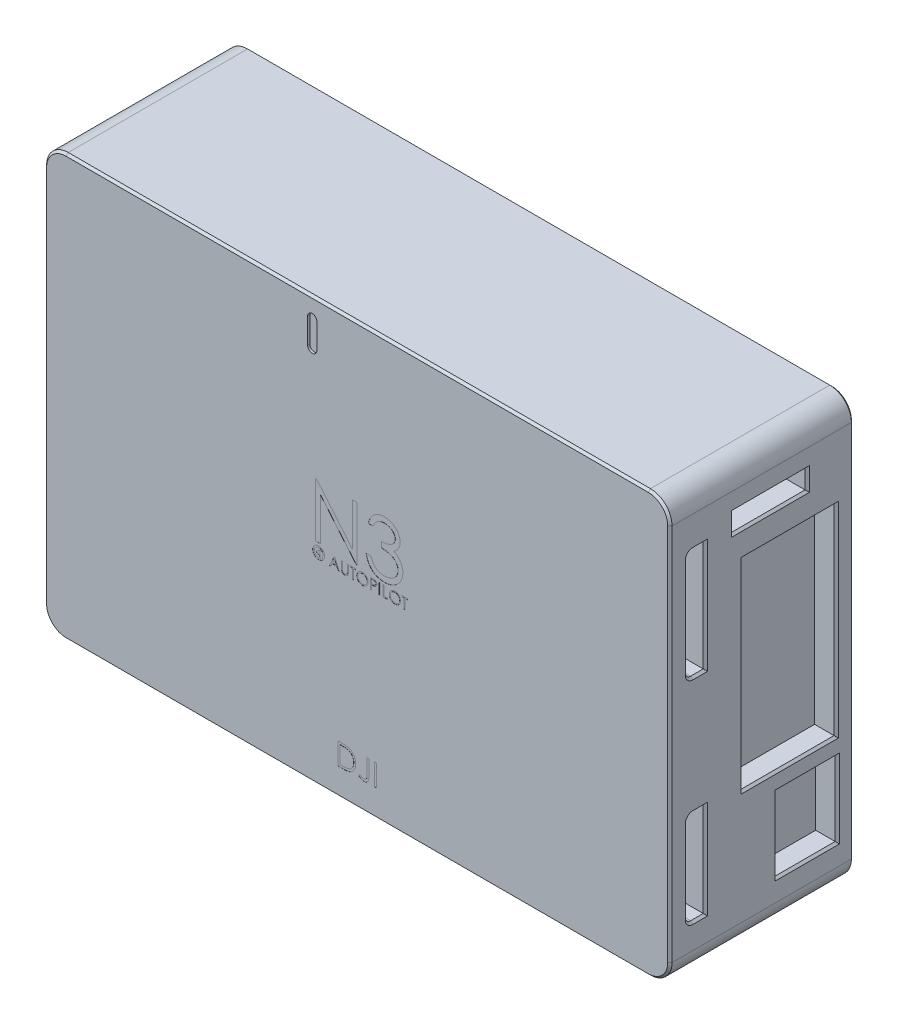
from build123d import *

# Parameters (mm, degrees)
SKETCH_1_W          = 57.9
SKETCH_1_H          = 39
EXTRUDE_1_DEPTH     = 8.5
WRAP_START          = -0.01
WRAP_1_OUTLINE_W    = 0.08974359
WRAP_1_OUTLINE_H    = 1
WRAP_1_OUTLINE_W_2  = 0.179487179
WRAP_1_OUTLINE_H_2  = 2
WRAP_1_DEPTH        = 0.01
WRAP_2_OUTLINE_R    = 0.550528327
WRAP_2_OUTLINE_R_2  = 0.409618736
WRAP_2_DEPTH        = 0.01
CUT_EXTRUDE_1_DEPTH = 0.2
FILLET_1_R          = 2
CUT_EXTRUDE_2_DEPTH = 2
SKETCH_6_W          = 7.8930681
SKETCH_6_H          = 2.741802603
SKETCH_6_H_2        = 8.807002301
SKETCH_6_H_3        = 8.142322883
CUT_EXTRUDE_3_DEPTH = 2
CHAMFER_1_SIZE      = 0.2
SKETCH_7_W          = 6.812964044
SKETCH_7_H          = 1.744783475
SKETCH_7_W_2        = 8.593393446
SKETCH_7_H_2        = 18.580781515
SKETCH_7_W_3        = 5.564428925
SKETCH_7_H_3        = 6.896048972
CUT_EXTRUDE_4_DEPTH = 2
CHAMFER_2_SIZE      = 0.2


# Read off the part's stored shape, not the designer's step: 包覆1, 包覆2
with BuildPart() as part:
    # 草图1 → 凸台-拉伸1 (new, symmetric)
    with BuildSketch(Plane.XY):
        Rectangle(SKETCH_1_W, SKETCH_1_H)
    extrude(amount=EXTRUDE_1_DEPTH, both=True)

    # 包覆1 outline → 包覆1 (cut)
    # profile 1 of 15: a face of its own
    with BuildSketch(Plane.XY.offset(8.5).offset(WRAP_START)):
        with BuildLine():
            add(Edge.make_bspline(
                [(4.022503773, -0.868523479), (4.022060935, -0.886511321), (4.02118805, -0.921967441), (4.013711257, -0.974008425), (4.001985257, -1.024034338), (3.985243466, -1.071961667), (3.963750473, -1.117840971), (3.937277567, -1.16155153), (3.906094364, -1.203107672), (3.870606692, -1.242054148), (3.83192068, -1.277767711), (3.790426318, -1.30888739), (3.747056798, -1.335665711), (3.701254024, -1.357032475), (3.653625442, -1.374110166), (3.603744778, -1.385753775), (3.551845763, -1.393264359), (3.516454048, -1.394126792), (3.498465311, -1.394565145)],
                knots=[0, 0, 0, 0, 0.065226504, 0.128568996, 0.190320378, 0.251377989, 0.312387528, 0.373788704, 0.43643116, 0.500566755, 0.564686795, 0.627135518, 0.688455409, 0.749245746, 0.810155177, 0.871670926, 0.934773496, 1, 1, 1, 1], degree=3))
            add(Edge.make_bspline(
                [(3.490452491, -0.343283094), (3.508969093, -0.343752088), (3.545337226, -0.344673231), (3.598787197, -0.351724404), (3.649814367, -0.363923087), (3.698834407, -0.380169653), (3.745260971, -0.401842335), (3.789443512, -0.428038091), (3.831276905, -0.459031365), (3.870197299, -0.494582573), (3.905813571, -0.53326356), (3.937192395, -0.574542963), (3.963490194, -0.618171192), (3.985086133, -0.664017143), (4.002028593, -0.711977134), (4.013719748, -0.762306849), (4.021187791, -0.814680189), (4.02206087, -0.850402151), (4.022503773, -0.868523479)],
                knots=[0, 0, 0, 0, 0.066570035, 0.130749041, 0.1934128, 0.254989399, 0.316113556, 0.377261758, 0.439400784, 0.502970589, 0.566524976, 0.628231103, 0.689090611, 0.749344669, 0.810169593, 0.871609824, 0.934869184, 1, 1, 1, 1], degree=3))
            add(Edge.make_bspline(
                [(2.971221722, -0.873331171), (2.971374475, -0.861436123), (2.971678054, -0.837796087), (2.975332823, -0.802691345), (2.980636166, -0.768151157), (2.988236713, -0.734273743), (2.998177189, -0.701142033), (3.00990634, -0.668527529), (3.02423201, -0.636760751), (3.040426481, -0.605691211), (3.058501283, -0.575803237), (3.078465783, -0.547551928), (3.099618745, -0.520700215), (3.122808286, -0.495943928), (3.147270128, -0.472562883), (3.173401093, -0.450916393), (3.201041734, -0.430809264), (3.230310985, -0.412689166), (3.260487635, -0.396300842), (3.291595286, -0.382237456), (3.323211449, -0.370167153), (3.355484206, -0.36038406), (3.388327855, -0.352660621), (3.421814079, -0.347401377), (3.455916201, -0.343737286), (3.478890864, -0.343435143), (3.490452491, -0.343283094)],
                knots=[0, 0, 0, 0, 0.043208986, 0.085872872, 0.128120007, 0.170151964, 0.211917621, 0.253753003, 0.296006409, 0.338443357, 0.381015368, 0.422820479, 0.464089056, 0.505125849, 0.545974971, 0.586985211, 0.628338592, 0.670083802, 0.711991602, 0.753039155, 0.794049395, 0.834885543, 0.875498313, 0.9165473, 0.958003779, 1, 1, 1, 1], degree=3))
            add(Edge.make_bspline(
                [(3.498465311, -1.394565145), (3.480344077, -1.394122463), (3.444622301, -1.393249819), (3.392183149, -1.385769418), (3.341818079, -1.374071903), (3.293671121, -1.357354921), (3.247715427, -1.335749998), (3.203861118, -1.30940589), (3.162284219, -1.278146706), (3.123329434, -1.242670542), (3.087686806, -1.204050099), (3.056612699, -1.162668883), (3.030262666, -1.119338753), (3.008730285, -1.07393946), (2.991683297, -1.026690476), (2.980053349, -0.977276626), (2.972528791, -0.925979624), (2.971661692, -0.891053082), (2.971221722, -0.873331171)],
                knots=[0, 0, 0, 0, 0.065818877, 0.129746527, 0.192071954, 0.253459424, 0.314569588, 0.376279881, 0.439025654, 0.503267029, 0.567492823, 0.629704796, 0.690999649, 0.751451651, 0.812004364, 0.873149681, 0.935635484, 1, 1, 1, 1], degree=3))
        make_face()
        with BuildLine():
            add(Edge.make_bspline(
                [(3.060965311, -0.87293053), (3.061329558, -0.887376879), (3.062046143, -0.915797316), (3.068319734, -0.957445357), (3.077983156, -0.997470582), (3.092228117, -1.035653984), (3.110042579, -1.07232378), (3.132050262, -1.107154667), (3.158124286, -1.140156059), (3.187742437, -1.171097565), (3.220120353, -1.199339223), (3.254501133, -1.224128768), (3.290516449, -1.245103125), (3.328260221, -1.262190289), (3.367530947, -1.275730214), (3.408581676, -1.285009823), (3.45113895, -1.291117096), (3.480147708, -1.291703598), (3.494859542, -1.292001043)],
                knots=[0, 0, 0, 0, 0.064503999, 0.126899322, 0.18774654, 0.248149733, 0.308586065, 0.369583005, 0.431826965, 0.496179723, 0.560667855, 0.623504455, 0.685260411, 0.746536822, 0.808327352, 0.870486188, 0.934316883, 1, 1, 1, 1], degree=3))
            add(Edge.make_bspline(
                [(3.494859542, -0.445847197), (3.485369647, -0.44596288), (3.46648058, -0.44619314), (3.438399284, -0.449226201), (3.410687303, -0.453549027), (3.383338914, -0.459715175), (3.356468546, -0.468116333), (3.329825734, -0.477785164), (3.303653433, -0.489562619), (3.278038045, -0.502869106), (3.253205166, -0.517597369), (3.229772966, -0.533875016), (3.207680782, -0.551320318), (3.186982706, -0.569973985), (3.167739514, -0.589931015), (3.149572456, -0.610888853), (3.133209718, -0.633446537), (3.118213839, -0.656992367), (3.104794456, -0.681495676), (3.092861498, -0.706698494), (3.083100352, -0.732806404), (3.075139674, -0.759536164), (3.068539728, -0.786845438), (3.064358606, -0.814941395), (3.061292218, -0.843682855), (3.061075119, -0.863106242), (3.060965311, -0.87293053)],
                knots=[0, 0, 0, 0, 0.042023329, 0.083644911, 0.124983795, 0.166247461, 0.207701556, 0.249631071, 0.29174177, 0.334742875, 0.377460169, 0.419556319, 0.461044176, 0.502096284, 0.542890714, 0.583800819, 0.624863583, 0.666224689, 0.707399186, 0.748556678, 0.789654591, 0.830739726, 0.872070142, 0.913993395, 0.95649813, 1, 1, 1, 1], degree=3))
            add(Edge.make_bspline(
                [(3.932760183, -0.868323158), (3.93264558, -0.858633014), (3.932418242, -0.839410828), (3.929406106, -0.810993452), (3.925091566, -0.78320682), (3.91887365, -0.756160019), (3.91085932, -0.729846155), (3.900977226, -0.704289941), (3.889324283, -0.679396171), (3.875950505, -0.655226372), (3.860917412, -0.63203359), (3.844490485, -0.609861472), (3.8263861, -0.589126403), (3.807121522, -0.56931649), (3.786215555, -0.550854236), (3.763762899, -0.533733516), (3.740036134, -0.517541152), (3.714914067, -0.502933848), (3.688987223, -0.489444068), (3.662383235, -0.477886638), (3.635403492, -0.468066033), (3.608116603, -0.459689757), (3.580292895, -0.453573177), (3.552120372, -0.449222305), (3.523638013, -0.446194195), (3.504482807, -0.44596323), (3.494859542, -0.445847197)],
                knots=[0, 0, 0, 0, 0.042915082, 0.085129971, 0.126473319, 0.167453038, 0.207976333, 0.248249378, 0.288749987, 0.329669857, 0.370537287, 0.411128564, 0.451818913, 0.492405877, 0.533485862, 0.575263062, 0.617440613, 0.660671688, 0.703940204, 0.746867522, 0.7890793, 0.831104042, 0.87323799, 0.91516577, 0.957380658, 1, 1, 1, 1], degree=3))
            add(Edge.make_bspline(
                [(3.494859542, -1.292001043), (3.504747971, -1.291865184), (3.524359696, -1.291595736), (3.553529845, -1.288881829), (3.582174477, -1.284529866), (3.610253414, -1.278263964), (3.637734789, -1.270421905), (3.664733304, -1.261105412), (3.690961387, -1.249482211), (3.716749912, -1.236639939), (3.741434553, -1.221999894), (3.76499899, -1.206274708), (3.78684927, -1.188855102), (3.807531862, -1.170478584), (3.826854059, -1.150774628), (3.844685197, -1.12976885), (3.860965235, -1.107328662), (3.87595542, -1.083818547), (3.889327781, -1.059248189), (3.900978952, -1.033953995), (3.910863556, -1.007998249), (3.918843129, -0.981343515), (3.925096118, -0.954040415), (3.929404667, -0.926052393), (3.932418506, -0.897435438), (3.932645671, -0.87808005), (3.932760183, -0.868323158)],
                knots=[0, 0, 0, 0, 0.043633218, 0.086537777, 0.129177336, 0.171436324, 0.213415895, 0.255265955, 0.297369481, 0.339940748, 0.382347459, 0.423952947, 0.464871163, 0.505572294, 0.546002577, 0.586567975, 0.627064799, 0.668270684, 0.709549225, 0.750428154, 0.791096194, 0.832027145, 0.873135955, 0.914610764, 0.956955986, 1, 1, 1, 1], degree=3))
        make_face(mode=Mode.SUBTRACT)
    # profile 2 of 15: a face of its own
    with BuildSketch(Plane.XY.offset(8.5).offset(WRAP_START)):
        with BuildLine():
            add(Edge.make_bspline(
                [(-1.378205128, -14.991346984), (-1.343079992, -14.991599882), (-1.275218412, -14.992088478), (-1.177154156, -14.995186415), (-1.086420578, -15.000666682), (-1.003316087, -15.008649268), (-0.927612537, -15.018451001), (-0.859521904, -15.030736947), (-0.798692108, -15.045244473), (-0.761280999, -15.057613301), (-0.743589744, -15.063462369)],
                knots=[0, 0, 0, 0, 0.164289216, 0.317405911, 0.458843612, 0.589366542, 0.707831319, 0.815770031, 0.912879903, 1, 1, 1, 1], degree=3))
            Line((-1.378205128, -14.991346984), (-1.782051282, -14.991346984))
            Line((-1.782051282, -14.991346984), (-1.782051282, -16.991346984))
            Line((-1.782051282, -16.991346984), (-1.162259615, -16.991346984))
            add(Edge.make_bspline(
                [(-0.141025641, -16.016587369), (-0.141385051, -16.041308077), (-0.142093306, -16.090022813), (-0.148452915, -16.161817611), (-0.157696526, -16.231482509), (-0.172007497, -16.298685766), (-0.189380361, -16.364016176), (-0.211645591, -16.426777459), (-0.237151589, -16.48754535), (-0.266894376, -16.545498193), (-0.299546596, -16.600402977), (-0.334587592, -16.652160422), (-0.37197999, -16.700031977), (-0.412080351, -16.744162613), (-0.454370475, -16.7844858), (-0.499127236, -16.82133838), (-0.546466122, -16.853999269), (-0.596175106, -16.883751902), (-0.649704323, -16.909706391), (-0.708067675, -16.931666397), (-0.771514062, -16.949864463), (-0.839887752, -16.965047832), (-0.913306882, -16.977092005), (-0.991843434, -16.985164229), (-1.075376742, -16.990623047), (-1.132736323, -16.991100987), (-1.162259615, -16.991346984)],
                knots=[0, 0, 0, 0, 0.046080683, 0.0908068, 0.134295271, 0.177024386, 0.218822734, 0.260244116, 0.301079867, 0.341613894, 0.381583419, 0.420119591, 0.458074619, 0.494738488, 0.531194623, 0.566933698, 0.602712651, 0.638326606, 0.674853249, 0.713467371, 0.754441804, 0.797815361, 0.843989456, 0.89307157, 0.944963346, 1, 1, 1, 1], degree=3))
            add(Edge.make_bspline(
                [(-0.743589744, -15.063462369), (-0.720449893, -15.072279915), (-0.674694926, -15.089715055), (-0.609547998, -15.12260437), (-0.54821922, -15.159868999), (-0.490379708, -15.201558064), (-0.437350665, -15.248851977), (-0.387060438, -15.29974174), (-0.34156631, -15.356077935), (-0.299904426, -15.416692214), (-0.262341192, -15.480870529), (-0.229690245, -15.548490591), (-0.202573678, -15.619208996), (-0.180063262, -15.69282908), (-0.162322429, -15.769512725), (-0.150218468, -15.84934922), (-0.142235046, -15.932023042), (-0.141432731, -15.988122736), (-0.141025641, -16.016587369)],
                knots=[0, 0, 0, 0, 0.061544966, 0.121694296, 0.181154855, 0.239875389, 0.298701942, 0.357647424, 0.417604843, 0.478494041, 0.540407051, 0.602344994, 0.665004328, 0.728559309, 0.793650542, 0.860534268, 0.929235961, 1, 1, 1, 1], degree=3))
        make_face()
        with BuildLine():
            add(Edge.make_bspline(
                [(-1.372996795, -16.786218779), (-1.340009154, -16.78607701), (-1.276561841, -16.785804336), (-1.1853287, -16.783411648), (-1.101969045, -16.779501969), (-1.026471039, -16.774030496), (-0.958877311, -16.766791288), (-0.899046597, -16.758719915), (-0.847175021, -16.748664229), (-0.815786771, -16.739549395), (-0.801282051, -16.735337369)],
                knots=[0, 0, 0, 0, 0.171900665, 0.330627932, 0.475548836, 0.60674619, 0.725023803, 0.829742387, 0.92132282, 1, 1, 1, 1], degree=3))
            Line((-1.372996795, -16.786218779), (-1.602564103, -16.786218779))
            Line((-1.602564103, -16.786218779), (-1.602564103, -15.19647519))
            Line((-1.602564103, -15.19647519), (-1.461939103, -15.19647519))
            add(Edge.make_bspline(
                [(-0.847355769, -15.252564933), (-0.864127853, -15.247926974), (-0.899789904, -15.238065401), (-0.957983884, -15.227308046), (-1.023478255, -15.217819761), (-1.096563799, -15.209786595), (-1.177157204, -15.204022412), (-1.265320454, -15.199695946), (-1.361091657, -15.19677787), (-1.427481676, -15.196578609), (-1.461939103, -15.19647519)],
                knots=[0, 0, 0, 0, 0.084318617, 0.179284514, 0.286582528, 0.405111483, 0.535592873, 0.67819021, 0.83297584, 1, 1, 1, 1], degree=3))
            add(Edge.make_bspline(
                [(-0.320512821, -16.016186728), (-0.320806128, -15.992796168), (-0.321382332, -15.946845205), (-0.328624795, -15.879421951), (-0.339208541, -15.814575865), (-0.354513504, -15.75230261), (-0.374016864, -15.692480695), (-0.398356659, -15.635440975), (-0.426166156, -15.58058105), (-0.459253777, -15.529167126), (-0.495491259, -15.480542493), (-0.53570719, -15.435996827), (-0.57926264, -15.395428655), (-0.625682554, -15.358206191), (-0.676275183, -15.325826947), (-0.72984872, -15.296863129), (-0.787189104, -15.27228262), (-0.827082073, -15.259208984), (-0.847355769, -15.252564933)],
                knots=[0, 0, 0, 0, 0.070151176, 0.137812606, 0.203226247, 0.267174055, 0.330024003, 0.391794272, 0.453084399, 0.514333908, 0.574999993, 0.634865483, 0.694116315, 0.753441622, 0.8131258, 0.874079686, 0.936007013, 1, 1, 1, 1], degree=3))
            add(Edge.make_bspline(
                [(-0.801282051, -16.735337369), (-0.783025844, -16.728907907), (-0.74694948, -16.716202551), (-0.695017431, -16.693026745), (-0.646584857, -16.665574133), (-0.6008077, -16.635058548), (-0.558335325, -16.60040369), (-0.518664401, -16.562363125), (-0.481874801, -16.520743253), (-0.448346625, -16.475595733), (-0.41834188, -16.427201564), (-0.39235832, -16.376036516), (-0.369586016, -16.322661196), (-0.351712535, -16.266255962), (-0.337703629, -16.207325072), (-0.327780951, -16.145864378), (-0.321601108, -16.08188536), (-0.320880281, -16.038369861), (-0.320512821, -16.016186728)],
                knots=[0, 0, 0, 0, 0.0624145, 0.123338231, 0.183124538, 0.241782995, 0.300578883, 0.359680075, 0.418881641, 0.479530664, 0.540850536, 0.602303396, 0.664463212, 0.727805723, 0.792894815, 0.859672328, 0.928464401, 1, 1, 1, 1], degree=3))
        make_face(mode=Mode.SUBTRACT)
    # profile 3 of 15: a face of its own
    with BuildSketch(Plane.XY.offset(8.5).offset(WRAP_START)):
        with BuildLine():
            add(Edge.make_bspline(
                [(1.08974359, -16.341907882), (1.089564208, -16.366882265), (1.089219772, -16.414836129), (1.087325823, -16.483906926), (1.083820979, -16.54697589), (1.078715257, -16.604186431), (1.071903696, -16.65535932), (1.064108823, -16.700889959), (1.054672938, -16.740398348), (1.040463528, -16.784761409), (1.017164129, -16.833415012), (0.98209725, -16.885960812), (0.938535652, -16.931922761), (0.888077919, -16.971838604), (0.830283048, -17.003642736), (0.766341208, -17.026474266), (0.696646016, -17.04040047), (0.648303609, -17.041871273), (0.623397436, -17.042629036)],
                knots=[0, 0, 0, 0, 0.077360684, 0.148541953, 0.214007737, 0.272994503, 0.326409196, 0.373880401, 0.416019938, 0.45212552, 0.518001711, 0.58236693, 0.647043782, 0.713330421, 0.78091197, 0.850394959, 0.922922974, 1, 1, 1, 1], degree=3))
            Line((1.08974359, -16.341907882), (1.08974359, -14.991346984))
            Line((1.08974359, -14.991346984), (0.91025641, -14.991346984))
            Line((0.91025641, -14.991346984), (0.91025641, -16.321875831))
            add(Edge.make_bspline(
                [(0.633413462, -16.837500831), (0.647232198, -16.836916411), (0.674546744, -16.835761228), (0.714240455, -16.825561642), (0.752216473, -16.809993412), (0.78711342, -16.787198387), (0.819276499, -16.760094718), (0.845815256, -16.727319856), (0.867939396, -16.690996436), (0.881253506, -16.656612748), (0.889736233, -16.625254674), (0.89512002, -16.596435739), (0.899827826, -16.562743466), (0.90393157, -16.524137637), (0.906334124, -16.480540961), (0.909029709, -16.432081451), (0.910004144, -16.37863693), (0.910169755, -16.341373529), (0.91025641, -16.321875831)],
                knots=[0, 0, 0, 0, 0.062326366, 0.123196245, 0.18403622, 0.246964085, 0.310699396, 0.373267637, 0.43658758, 0.502124791, 0.539004722, 0.583255376, 0.634446515, 0.692676046, 0.758570486, 0.831658675, 0.911917102, 1, 1, 1, 1], degree=3))
            add(Edge.make_bspline(
                [(0.502403846, -16.808654677), (0.513423453, -16.812974367), (0.535035355, -16.82144624), (0.568078258, -16.83090104), (0.600932565, -16.836068131), (0.622714104, -16.837028893), (0.633413462, -16.837500831)],
                knots=[0, 0, 0, 0, 0.262951626, 0.515706692, 0.762109227, 1, 1, 1, 1], degree=3))
            add(Edge.make_bspline(
                [(0.246794872, -16.658013651), (0.271196403, -16.674840735), (0.317269675, -16.706612462), (0.384986498, -16.747484806), (0.444984871, -16.782527757), (0.48423227, -16.800386203), (0.502403846, -16.808654677)],
                knots=[0, 0, 0, 0, 0.299184288, 0.564898946, 0.798547869, 1, 1, 1, 1], degree=3))
            Line((0.246794872, -16.658013651), (0.141025641, -16.811859805))
            add(Edge.make_bspline(
                [(0.623397436, -17.042629036), (0.60399266, -17.042011545), (0.564948965, -17.040769112), (0.506839988, -17.030642419), (0.448896002, -17.015033251), (0.39080946, -16.992174625), (0.331432751, -16.961085712), (0.269961695, -16.920408674), (0.205605586, -16.87021923), (0.163215137, -16.831911947), (0.141025641, -16.811859805)],
                knots=[0, 0, 0, 0, 0.106070902, 0.21342168, 0.321685488, 0.433857939, 0.554081283, 0.687587044, 0.83646585, 1, 1, 1, 1], degree=3))
        make_face()
    # profile 4 of 15: a face of its own
    with BuildSketch(Plane.XY.offset(8.5).offset(WRAP_START)):
        with BuildLine():
            add(Edge.make_bspline(
                [(-1.362111612, -0.968082774), (-1.362124967, -0.976562984), (-1.362150311, -0.992655644), (-1.361981022, -1.015560873), (-1.361506916, -1.035924433), (-1.361208014, -1.053824818), (-1.360543061, -1.069179888), (-1.360000762, -1.082072834), (-1.35930346, -1.092442606), (-1.358465427, -1.098494299), (-1.358105201, -1.101095594)],
                knots=[0, 0, 0, 0, 0.191078592, 0.362604556, 0.51609875, 0.650038026, 0.765976721, 0.862374026, 0.940842058, 1, 1, 1, 1], degree=3))
            Line((-1.362111612, -0.968082774), (-1.362111612, -0.36892412))
            Line((-1.362111612, -0.36892412), (-1.451855201, -0.36892412))
            Line((-1.451855201, -0.36892412), (-1.451855201, -0.972890466))
            add(Edge.make_bspline(
                [(-1.434026676, -1.183627645), (-1.435505864, -1.178304053), (-1.438714256, -1.166757062), (-1.442150055, -1.147646636), (-1.445038364, -1.125642374), (-1.447754238, -1.100742769), (-1.449356797, -1.072928521), (-1.45076178, -1.042211688), (-1.451865099, -1.008555128), (-1.451858593, -0.98511098), (-1.451855201, -0.972890466)],
                knots=[0, 0, 0, 0, 0.078129865, 0.169465417, 0.274335291, 0.392110163, 0.52368733, 0.668365421, 0.827131902, 1, 1, 1, 1], degree=3))
            add(Edge.make_bspline(
                [(-1.121526676, -1.394565145), (-1.131146419, -1.394340927), (-1.150020322, -1.393901011), (-1.177831198, -1.391380225), (-1.204492397, -1.386632112), (-1.230285505, -1.380586414), (-1.254859361, -1.372248203), (-1.278543202, -1.362505882), (-1.300931397, -1.35054095), (-1.322387148, -1.337228552), (-1.342337078, -1.322250084), (-1.360650622, -1.30592432), (-1.377358014, -1.288512784), (-1.392177641, -1.269826965), (-1.405355037, -1.250012192), (-1.416706526, -1.229012409), (-1.426453168, -1.206835747), (-1.431483615, -1.191420547), (-1.434026676, -1.183627645)],
                knots=[0, 0, 0, 0, 0.071174504, 0.139644122, 0.206317224, 0.27137324, 0.335418084, 0.398076345, 0.460607915, 0.522969511, 0.584715724, 0.64489494, 0.704290561, 0.76299819, 0.821087431, 0.880103891, 0.939388488, 1, 1, 1, 1], degree=3))
            add(Edge.make_bspline(
                [(-0.81082956, -0.972890466), (-0.810902166, -0.983775717), (-0.811043861, -1.005018946), (-0.812272597, -1.036147906), (-0.81423174, -1.065677329), (-0.816999765, -1.093611186), (-0.82066748, -1.119849517), (-0.824746115, -1.144622308), (-0.829940267, -1.167751734), (-0.836006953, -1.189418139), (-0.842942252, -1.210042572), (-0.851925438, -1.229616461), (-0.862046723, -1.248734861), (-0.87405091, -1.267108607), (-0.887539876, -1.284819051), (-0.902811785, -1.301758786), (-0.919361545, -1.318198514), (-0.937464277, -1.333716533), (-0.95682157, -1.347947583), (-0.977375843, -1.360461232), (-0.998969206, -1.371039408), (-1.021545528, -1.379746815), (-1.045114443, -1.386293844), (-1.069676546, -1.39117246), (-1.095287744, -1.393944545), (-1.112706217, -1.394356525), (-1.121526676, -1.394565145)],
                knots=[0, 0, 0, 0, 0.054858035, 0.107058792, 0.156978355, 0.203992277, 0.248491536, 0.290483314, 0.330489004, 0.367885926, 0.403858131, 0.440009343, 0.476295011, 0.512792295, 0.550484825, 0.588381116, 0.627645327, 0.667979464, 0.708432758, 0.748602302, 0.789087777, 0.829461205, 0.870371045, 0.912214227, 0.955546575, 1, 1, 1, 1], degree=3))
            Line((-0.81082956, -0.972890466), (-0.81082956, -0.36892412))
            Line((-0.81082956, -0.36892412), (-0.90057315, -0.36892412))
            Line((-0.90057315, -0.36892412), (-0.90057315, -0.968082774))
            add(Edge.make_bspline(
                [(-0.910789496, -1.123331171), (-0.909932318, -1.119803007), (-0.908022178, -1.111940835), (-0.906237308, -1.098649038), (-0.904378301, -1.082966363), (-0.903088424, -1.064780131), (-0.901830932, -1.044151281), (-0.901078626, -1.02097235), (-0.900730902, -0.995327505), (-0.900627279, -0.977431173), (-0.90057315, -0.968082774)],
                knots=[0, 0, 0, 0, 0.069835104, 0.155620755, 0.257801557, 0.373811234, 0.506402493, 0.655564458, 0.820079282, 1, 1, 1, 1], degree=3))
            add(Edge.make_bspline(
                [(-1.126534689, -1.292001043), (-1.118376477, -1.291694228), (-1.102107174, -1.291082372), (-1.077933908, -1.287293391), (-1.05439102, -1.280464658), (-1.031362254, -1.271653299), (-1.009776258, -1.26001113), (-0.989620989, -1.246562319), (-0.971631294, -1.230787783), (-0.955214723, -1.213330541), (-0.940919027, -1.193633456), (-0.928527272, -1.172125416), (-0.918377007, -1.148482746), (-0.913364571, -1.131867197), (-0.910789496, -1.123331171)],
                knots=[0, 0, 0, 0, 0.082890648, 0.165302541, 0.247761876, 0.331527711, 0.415279813, 0.49636623, 0.577151348, 0.65778254, 0.739321642, 0.823793082, 0.909475953, 1, 1, 1, 1], degree=3))
            add(Edge.make_bspline(
                [(-1.358105201, -1.101095594), (-1.356625927, -1.110480384), (-1.353750731, -1.128721163), (-1.346423195, -1.154694958), (-1.336189623, -1.178103946), (-1.324063039, -1.199678601), (-1.308082293, -1.218818418), (-1.288938426, -1.236450319), (-1.265744778, -1.251870834), (-1.239956034, -1.265971066), (-1.212160251, -1.277303947), (-1.183757032, -1.28587348), (-1.155173324, -1.291096023), (-1.136037277, -1.291700748), (-1.126534689, -1.292001043)],
                knots=[0, 0, 0, 0, 0.086315004, 0.167766466, 0.244432684, 0.318134662, 0.391884107, 0.47006805, 0.553904179, 0.644339498, 0.736874663, 0.826168364, 0.913678595, 1, 1, 1, 1], degree=3))
        make_face()
    # profile 5 of 15: a face of its own
    with BuildSketch(Plane.XY.offset(8.5).offset(WRAP_START)):
        with BuildLine():
            add(Edge.make_bspline(
                [(1.025641026, 3.846153846), (1.037797527, 3.896485966), (1.061562492, 3.994881144), (1.111130454, 4.135462945), (1.16512939, 4.268496547), (1.229970968, 4.391490938), (1.300697759, 4.506917942), (1.381730219, 4.612159548), (1.469329822, 4.709892356), (1.566222607, 4.796625553), (1.667834981, 4.875165166), (1.775598723, 4.942129533), (1.887345714, 4.999735466), (2.00385019, 5.04719294), (2.125459007, 5.082943688), (2.251072754, 5.108881982), (2.381020612, 5.125726431), (2.469231455, 5.127370378), (2.514022436, 5.128205128)],
                knots=[0, 0, 0, 0, 0.072625346, 0.141976611, 0.208984928, 0.27395687, 0.336889347, 0.398744953, 0.460115885, 0.520824923, 0.580994459, 0.640151928, 0.698622451, 0.757271081, 0.816426694, 0.876254048, 0.937165293, 1, 1, 1, 1], degree=3))
            Line((1.025641026, 3.846153846), (1.474358974, 3.846153846))
            add(Edge.make_bspline(
                [(2.520032051, 4.615384615), (2.463101097, 4.613396955), (2.351901702, 4.609514593), (2.191594678, 4.575510288), (2.042567058, 4.521255883), (1.928654677, 4.456494427), (1.844536714, 4.392565236), (1.784426802, 4.336733255), (1.725397502, 4.274686364), (1.671332249, 4.202602971), (1.61665514, 4.125364699), (1.566877195, 4.039045154), (1.518506206, 3.945896019), (1.489359706, 3.880045113), (1.474358974, 3.846153846)],
                knots=[0, 0, 0, 0, 0.122711942, 0.239684964, 0.351815855, 0.463766133, 0.520817793, 0.579448291, 0.640604145, 0.705297512, 0.773633881, 0.844669382, 0.920056508, 1, 1, 1, 1], degree=3))
            add(Edge.make_bspline(
                [(3.525641026, 3.831129808), (3.52504901, 3.857240872), (3.523871223, 3.909187597), (3.509017969, 3.985080552), (3.48669791, 4.058653332), (3.456012583, 4.129593061), (3.41494087, 4.197407738), (3.365789461, 4.262675522), (3.307263603, 4.325023778), (3.240198679, 4.38313852), (3.168181815, 4.438523144), (3.089253565, 4.485542626), (3.005793744, 4.525749857), (2.917709951, 4.558906289), (2.824716336, 4.583848129), (2.727249826, 4.601756474), (2.625124563, 4.612953124), (2.555450661, 4.614565146), (2.520032051, 4.615384615)],
                knots=[0, 0, 0, 0, 0.055274549, 0.109966094, 0.163247443, 0.218076185, 0.273300874, 0.3309093, 0.390994523, 0.454175953, 0.518861541, 0.583310532, 0.648516682, 0.715030887, 0.782502073, 0.852322685, 0.92492849, 1, 1, 1, 1], degree=3))
            add(Edge.make_bspline(
                [(2.243589744, 3.012820513), (2.305448552, 3.013870232), (2.426614761, 3.015926375), (2.603606625, 3.040794962), (2.772854214, 3.075195859), (2.930606702, 3.127888991), (3.074390579, 3.189089415), (3.199132867, 3.260306857), (3.303085935, 3.339470784), (3.385744608, 3.427803083), (3.447929221, 3.522538865), (3.493396074, 3.621276948), (3.520253683, 3.724882749), (3.523838922, 3.795589418), (3.525641026, 3.831129808)],
                knots=[0, 0, 0, 0, 0.110165553, 0.215787256, 0.318027435, 0.417573954, 0.511650488, 0.596162097, 0.672934533, 0.743669557, 0.810677001, 0.874058962, 0.936696302, 1, 1, 1, 1], degree=3))
            Line((2.243589744, 3.012820513), (2.243589744, 2.5))
            add(Edge.make_bspline(
                [(3.782051282, 1.442307692), (3.779865137, 1.488895319), (3.775503725, 1.58183876), (3.742205754, 1.718578151), (3.687435948, 1.850325884), (3.610760932, 1.974834155), (3.517424177, 2.0902283), (3.408331453, 2.193187561), (3.282576841, 2.278144834), (3.166834171, 2.336842914), (3.064312519, 2.376895879), (2.976576255, 2.403574399), (2.878352536, 2.426165336), (2.770829181, 2.447182867), (2.653196014, 2.465070507), (2.525581103, 2.479987387), (2.387958586, 2.49192316), (2.292685492, 2.497253296), (2.243589744, 2.5)],
                knots=[0, 0, 0, 0, 0.066909186, 0.13348544, 0.201035117, 0.27123434, 0.342879984, 0.41383613, 0.485976622, 0.560229557, 0.599884181, 0.64405484, 0.691891932, 0.744687524, 0.801491775, 0.862857698, 0.929328379, 1, 1, 1, 1], degree=3))
            add(Edge.make_bspline(
                [(2.509014423, 0.384615385), (2.555805141, 0.385495249), (2.647300351, 0.387215749), (2.780807293, 0.403038187), (2.907817932, 0.426081635), (3.026922112, 0.46167161), (3.13967998, 0.505644255), (3.244510908, 0.560856263), (3.342791059, 0.625634437), (3.433261639, 0.699261806), (3.514612364, 0.779863942), (3.58624024, 0.864168329), (3.647132613, 0.951819514), (3.696252011, 1.043302544), (3.735038511, 1.138238585), (3.761443083, 1.236894056), (3.779802391, 1.338461579), (3.781297551, 1.407502963), (3.782051282, 1.442307692)],
                knots=[0, 0, 0, 0, 0.076071737, 0.148751715, 0.218402794, 0.285759581, 0.350598024, 0.414964045, 0.478069339, 0.541760676, 0.604349859, 0.664075021, 0.721463623, 0.777587128, 0.832644447, 0.887843511, 0.943460343, 1, 1, 1, 1], degree=3))
            add(Edge.make_bspline(
                [(1.673677885, 0.655048077), (1.701672994, 0.633464743), (1.757576798, 0.590364697), (1.848674271, 0.535362371), (1.944481251, 0.487703763), (2.047073643, 0.451298484), (2.154237601, 0.420473254), (2.267705265, 0.400301084), (2.386475575, 0.386460839), (2.46757238, 0.385239508), (2.509014423, 0.384615385)],
                knots=[0, 0, 0, 0, 0.118271305, 0.236177533, 0.355662933, 0.475904165, 0.600127342, 0.728608116, 0.861313476, 1, 1, 1, 1], degree=3))
            add(Edge.make_bspline(
                [(1.282051282, 1.346153846), (1.293741698, 1.307655256), (1.316480574, 1.232772153), (1.355186714, 1.125000288), (1.399284245, 1.026203069), (1.446590758, 0.935655752), (1.496274252, 0.852466606), (1.551867002, 0.778835364), (1.609251495, 0.711527933), (1.652507714, 0.673607058), (1.673677885, 0.655048077)],
                knots=[0, 0, 0, 0, 0.149770386, 0.29131641, 0.425966373, 0.552159574, 0.671527414, 0.786121629, 0.895325073, 1, 1, 1, 1], degree=3))
            Line((1.282051282, 1.346153846), (0.833333333, 1.346153846))
            add(Edge.make_bspline(
                [(2.501001603, -0.128205128), (2.447545459, -0.126964824), (2.342361595, -0.124524318), (2.187728026, -0.107840602), (2.040125598, -0.077369166), (1.899354744, -0.036364444), (1.765290406, 0.015623759), (1.638341685, 0.080364757), (1.517727551, 0.156524045), (1.404586192, 0.245000599), (1.298931096, 0.343973942), (1.203570061, 0.455201099), (1.116913214, 0.576625962), (1.041280873, 0.709658899), (0.973228083, 0.852580695), (0.917255288, 1.007221407), (0.86799019, 1.172198581), (0.845085241, 1.287166782), (0.833333333, 1.346153846)],
                knots=[0, 0, 0, 0, 0.06554117, 0.128963168, 0.190377136, 0.250092362, 0.308548432, 0.366397963, 0.424542189, 0.483169996, 0.5422434, 0.601739352, 0.662506002, 0.724855513, 0.789127829, 0.8563464, 0.926295235, 1, 1, 1, 1], degree=3))
            add(Edge.make_bspline(
                [(4.230769231, 1.485376603), (4.22820564, 1.415362715), (4.223090523, 1.275664427), (4.177370417, 1.069271967), (4.106494359, 0.86752125), (4.005841593, 0.674557194), (3.883173723, 0.494013792), (3.737234689, 0.332476208), (3.569682677, 0.193621059), (3.382817464, 0.077606447), (3.180364423, -0.015133441), (2.963827863, -0.079501217), (2.736327786, -0.121424074), (2.580317361, -0.125919601), (2.501001603, -0.128205128)],
                knots=[0, 0, 0, 0, 0.079648251, 0.158921676, 0.239619495, 0.32260943, 0.406034637, 0.487602095, 0.569684627, 0.653036145, 0.737435718, 0.822477816, 0.909747655, 1, 1, 1, 1], degree=3))
            add(Edge.make_bspline(
                [(3.932291667, 2.373798077), (3.956350727, 2.340858432), (4.004074864, 2.275518551), (4.06298277, 2.170466514), (4.116424362, 2.064250101), (4.158067532, 1.954022378), (4.190315913, 1.84106093), (4.213367388, 1.725171792), (4.227687589, 1.606260332), (4.229738378, 1.525813932), (4.230769231, 1.485376603)],
                knots=[0, 0, 0, 0, 0.12813551, 0.254172712, 0.378111645, 0.501712263, 0.623986309, 0.747095614, 0.872874637, 1, 1, 1, 1], degree=3))
            add(Edge.make_bspline(
                [(3.390424679, 2.800480769), (3.4436129, 2.774797667), (3.548994149, 2.723912013), (3.692637763, 2.624118074), (3.823034728, 2.508894721), (3.895754326, 2.418976645), (3.932291667, 2.373798077)],
                knots=[0, 0, 0, 0, 0.2538796, 0.503008917, 0.750291081, 1, 1, 1, 1], degree=3))
            add(Edge.make_bspline(
                [(3.974358974, 3.829126603), (3.972696701, 3.776259753), (3.969443891, 3.672807532), (3.941824312, 3.521776822), (3.895343936, 3.379431679), (3.830958561, 3.245172876), (3.747613489, 3.119851676), (3.646652494, 3.003186118), (3.527362977, 2.894658749), (3.436964494, 2.832488073), (3.390424679, 2.800480769)],
                knots=[0, 0, 0, 0, 0.128067549, 0.250608319, 0.370630166, 0.490072247, 0.610374764, 0.73431307, 0.863216504, 1, 1, 1, 1], degree=3))
            add(Edge.make_bspline(
                [(2.514022436, 5.128205128), (2.579283496, 5.126234799), (2.708382083, 5.12233712), (2.898043579, 5.086745068), (3.080939035, 5.03042345), (3.255066531, 4.95260384), (3.416807149, 4.856621964), (3.560715988, 4.742386626), (3.684842432, 4.612101909), (3.788977257, 4.468198246), (3.87051297, 4.314404661), (3.930636361, 4.156118722), (3.967238762, 3.993715906), (3.971982415, 3.88406265), (3.974358974, 3.829126603)],
                knots=[0, 0, 0, 0, 0.090254249, 0.178539792, 0.266093034, 0.354630978, 0.441886153, 0.525746915, 0.608113634, 0.690197273, 0.770821484, 0.848326181, 0.92401174, 1, 1, 1, 1], degree=3))
        make_face()
    # profile 6 of 15: a face of its own
    with BuildSketch(Plane.XY.offset(8.5).offset(WRAP_START)):
        with BuildLine():
            add(Edge.make_bspline(
                [(1.00968326, -0.868523479), (1.009240422, -0.886511321), (1.008367538, -0.921967441), (1.000890744, -0.974008425), (0.989164744, -1.024034338), (0.972422954, -1.071961667), (0.95092996, -1.117840971), (0.924457054, -1.16155153), (0.893273851, -1.203107672), (0.857786179, -1.242054148), (0.819100167, -1.277767711), (0.777605805, -1.30888739), (0.734236285, -1.335665711), (0.688433511, -1.357032475), (0.640804929, -1.374110166), (0.590924266, -1.385753775), (0.53902525, -1.393264359), (0.503633535, -1.394126792), (0.485644799, -1.394565145)],
                knots=[0, 0, 0, 0, 0.065226504, 0.128568996, 0.190320378, 0.251377989, 0.312387528, 0.373788704, 0.43643116, 0.500566755, 0.564686795, 0.627135518, 0.688455409, 0.749245746, 0.810155177, 0.871670926, 0.934773496, 1, 1, 1, 1], degree=3))
            add(Edge.make_bspline(
                [(0.477631978, -0.343283094), (0.49614858, -0.343752088), (0.532516713, -0.344673231), (0.585966684, -0.351724404), (0.636993854, -0.363923087), (0.686013894, -0.380169653), (0.732440458, -0.401842335), (0.776622999, -0.428038091), (0.818456392, -0.459031365), (0.857376786, -0.494582573), (0.892993058, -0.53326356), (0.924371883, -0.574542963), (0.950669681, -0.618171192), (0.97226562, -0.664017143), (0.98920808, -0.711977134), (1.000899235, -0.762306849), (1.008367278, -0.814680189), (1.009240357, -0.850402151), (1.00968326, -0.868523479)],
                knots=[0, 0, 0, 0, 0.066570035, 0.130749041, 0.1934128, 0.254989399, 0.316113556, 0.377261758, 0.439400784, 0.502970589, 0.566524976, 0.628231103, 0.689090611, 0.749344669, 0.810169593, 0.871609824, 0.934869184, 1, 1, 1, 1], degree=3))
            add(Edge.make_bspline(
                [(-0.041598791, -0.873331171), (-0.041446038, -0.861436123), (-0.041142459, -0.837796087), (-0.03748769, -0.802691345), (-0.032184347, -0.768151157), (-0.0245838, -0.734273743), (-0.014643324, -0.701142033), (-0.002914173, -0.668527529), (0.011411497, -0.636760751), (0.027605968, -0.605691211), (0.04568077, -0.575803237), (0.06564527, -0.547551928), (0.086798232, -0.520700215), (0.109987773, -0.495943928), (0.134449615, -0.472562883), (0.16058058, -0.450916393), (0.188221221, -0.430809264), (0.217490473, -0.412689166), (0.247667123, -0.396300842), (0.278774773, -0.382237456), (0.310390937, -0.370167153), (0.342663693, -0.36038406), (0.375507342, -0.352660621), (0.408993566, -0.347401377), (0.443095688, -0.343737286), (0.466070351, -0.343435143), (0.477631978, -0.343283094)],
                knots=[0, 0, 0, 0, 0.043208986, 0.085872872, 0.128120007, 0.170151964, 0.211917621, 0.253753003, 0.296006409, 0.338443357, 0.381015368, 0.422820479, 0.464089056, 0.505125849, 0.545974971, 0.586985211, 0.628338592, 0.670083802, 0.711991602, 0.753039155, 0.794049395, 0.834885543, 0.875498313, 0.9165473, 0.958003779, 1, 1, 1, 1], degree=3))
            add(Edge.make_bspline(
                [(0.485644799, -1.394565145), (0.467523565, -1.394122463), (0.431801789, -1.393249819), (0.379362636, -1.385769418), (0.328997566, -1.374071903), (0.280850609, -1.357354921), (0.234894914, -1.335749998), (0.191040605, -1.30940589), (0.149463706, -1.278146706), (0.110508921, -1.242670542), (0.074866293, -1.204050099), (0.043792186, -1.162668883), (0.017442153, -1.119338753), (-0.004090227, -1.07393946), (-0.021137216, -1.026690476), (-0.032767164, -0.977276626), (-0.040291722, -0.925979624), (-0.041158821, -0.891053082), (-0.041598791, -0.873331171)],
                knots=[0, 0, 0, 0, 0.065818877, 0.129746527, 0.192071954, 0.253459424, 0.314569588, 0.376279881, 0.439025654, 0.503267029, 0.567492823, 0.629704796, 0.690999649, 0.751451651, 0.812004364, 0.873149681, 0.935635484, 1, 1, 1, 1], degree=3))
        make_face()
        with BuildLine():
            add(Edge.make_bspline(
                [(0.048144799, -0.87293053), (0.048509045, -0.887376879), (0.04922563, -0.915797316), (0.055499221, -0.957445357), (0.065162643, -0.997470582), (0.079407605, -1.035653984), (0.097222066, -1.07232378), (0.119229749, -1.107154667), (0.145303773, -1.140156059), (0.174921924, -1.171097565), (0.20729984, -1.199339223), (0.24168062, -1.224128768), (0.277695936, -1.245103125), (0.315439709, -1.262190289), (0.354710434, -1.275730214), (0.395761163, -1.285009823), (0.438318437, -1.291117096), (0.467327196, -1.291703598), (0.482039029, -1.292001043)],
                knots=[0, 0, 0, 0, 0.064503999, 0.126899322, 0.18774654, 0.248149733, 0.308586065, 0.369583005, 0.431826965, 0.496179723, 0.560667855, 0.623504455, 0.685260411, 0.746536822, 0.808327352, 0.870486188, 0.934316883, 1, 1, 1, 1], degree=3))
            add(Edge.make_bspline(
                [(0.482039029, -0.445847197), (0.472549134, -0.44596288), (0.453660068, -0.44619314), (0.425578771, -0.449226201), (0.39786679, -0.453549027), (0.370518401, -0.459715175), (0.343648033, -0.468116333), (0.317005221, -0.477785164), (0.29083292, -0.489562619), (0.265217532, -0.502869106), (0.240384653, -0.517597369), (0.216952453, -0.533875016), (0.194860269, -0.551320318), (0.174162193, -0.569973985), (0.154919001, -0.589931015), (0.136751943, -0.610888853), (0.120389206, -0.633446537), (0.105393326, -0.656992367), (0.091973944, -0.681495676), (0.080040985, -0.706698494), (0.07027984, -0.732806404), (0.062319161, -0.759536164), (0.055719215, -0.786845438), (0.051538094, -0.814941395), (0.048471705, -0.843682855), (0.048254606, -0.863106242), (0.048144799, -0.87293053)],
                knots=[0, 0, 0, 0, 0.042023329, 0.083644911, 0.124983795, 0.166247461, 0.207701556, 0.249631071, 0.29174177, 0.334742875, 0.377460169, 0.419556319, 0.461044176, 0.502096284, 0.542890714, 0.583800819, 0.624863583, 0.666224689, 0.707399186, 0.748556678, 0.789654591, 0.830739726, 0.872070142, 0.913993395, 0.95649813, 1, 1, 1, 1], degree=3))
            add(Edge.make_bspline(
                [(0.91993967, -0.868323158), (0.919825067, -0.858633014), (0.919597729, -0.839410828), (0.916585594, -0.810993452), (0.912271053, -0.78320682), (0.906053137, -0.756160019), (0.898038807, -0.729846155), (0.888156713, -0.704289941), (0.87650377, -0.679396171), (0.863129992, -0.655226372), (0.848096899, -0.63203359), (0.831669973, -0.609861472), (0.813565587, -0.589126403), (0.794301009, -0.56931649), (0.773395042, -0.550854236), (0.750942386, -0.533733516), (0.727215621, -0.517541152), (0.702093554, -0.502933848), (0.67616671, -0.489444068), (0.649562722, -0.477886638), (0.622582979, -0.468066033), (0.59529609, -0.459689757), (0.567472382, -0.453573177), (0.539299859, -0.449222305), (0.5108175, -0.446194195), (0.491662294, -0.44596323), (0.482039029, -0.445847197)],
                knots=[0, 0, 0, 0, 0.042915082, 0.085129971, 0.126473319, 0.167453038, 0.207976333, 0.248249378, 0.288749987, 0.329669857, 0.370537287, 0.411128564, 0.451818913, 0.492405877, 0.533485862, 0.575263062, 0.617440613, 0.660671688, 0.703940204, 0.746867522, 0.7890793, 0.831104042, 0.87323799, 0.91516577, 0.957380658, 1, 1, 1, 1], degree=3))
            add(Edge.make_bspline(
                [(0.482039029, -1.292001043), (0.491927458, -1.291865184), (0.511539183, -1.291595736), (0.540709332, -1.288881829), (0.569353964, -1.284529866), (0.597432901, -1.278263964), (0.624914276, -1.270421905), (0.651912791, -1.261105412), (0.678140874, -1.249482211), (0.703929399, -1.236639939), (0.72861404, -1.221999894), (0.752178478, -1.206274708), (0.774028758, -1.188855102), (0.794711349, -1.170478584), (0.814033546, -1.150774628), (0.831864685, -1.12976885), (0.848144722, -1.107328662), (0.863134907, -1.083818547), (0.876507268, -1.059248189), (0.888158439, -1.033953995), (0.898043044, -1.007998249), (0.906022616, -0.981343515), (0.912275605, -0.954040415), (0.916584154, -0.926052393), (0.919597994, -0.897435438), (0.919825158, -0.87808005), (0.91993967, -0.868323158)],
                knots=[0, 0, 0, 0, 0.043633218, 0.086537777, 0.129177336, 0.171436324, 0.213415895, 0.255265955, 0.297369481, 0.339940748, 0.382347459, 0.423952947, 0.464871163, 0.505572294, 0.546002577, 0.586567975, 0.627064799, 0.668270684, 0.709549225, 0.750428154, 0.791096194, 0.832027145, 0.873135955, 0.914610764, 0.956955986, 1, 1, 1, 1], degree=3))
        make_face(mode=Mode.SUBTRACT)
    # profile 7 of 15: a face of its own
    with BuildSketch(Plane.XY.offset(8.5).offset(WRAP_START)):
        with BuildLine():
            add(Edge.make_bspline(
                [(1.410925247, -0.36892412), (1.424414078, -0.368938947), (1.450259276, -0.368967357), (1.48732072, -0.369828713), (1.520980643, -0.370979197), (1.551166467, -0.372574023), (1.577971066, -0.374458763), (1.601273152, -0.377102203), (1.621255882, -0.379862288), (1.633229153, -0.382668404), (1.63868967, -0.383948158)],
                knots=[0, 0, 0, 0, 0.176955752, 0.33905508, 0.486318225, 0.618780923, 0.735618828, 0.838742477, 0.926457068, 1, 1, 1, 1], degree=3))
            Line((1.410925247, -0.36892412), (1.214811465, -0.36892412))
            Line((1.214811465, -0.36892412), (1.214811465, -1.36892412))
            Line((1.214811465, -1.36892412), (1.304555055, -1.36892412))
            Line((1.304555055, -1.36892412), (1.304555055, -0.907385658))
            Line((1.304555055, -0.907385658), (1.376069478, -0.907385658))
            add(Edge.make_bspline(
                [(1.63067685, -0.890959376), (1.624411897, -0.892291656), (1.61068189, -0.895211426), (1.588069683, -0.898470985), (1.56174243, -0.901253157), (1.531736064, -0.903339196), (1.49807752, -0.905125016), (1.460748589, -0.906544471), (1.419675996, -0.907324429), (1.391027069, -0.907364656), (1.376069478, -0.907385658)],
                knots=[0, 0, 0, 0, 0.075173117, 0.164746258, 0.268016881, 0.385911876, 0.517789479, 0.663690977, 0.824413221, 1, 1, 1, 1], degree=3))
            add(Edge.make_bspline(
                [(1.830196081, -0.637153286), (1.830075674, -0.645375508), (1.829840089, -0.661462841), (1.827012579, -0.684997923), (1.823203953, -0.707488892), (1.817347652, -0.728885878), (1.80967746, -0.749061812), (1.80067973, -0.768325021), (1.789827293, -0.786347785), (1.777357342, -0.803195533), (1.763485458, -0.818884079), (1.748270333, -0.833299734), (1.731773392, -0.846358117), (1.714047064, -0.858088501), (1.694918536, -0.868218866), (1.67467792, -0.877292382), (1.653149287, -0.884912685), (1.638251426, -0.888921274), (1.63067685, -0.890959376)],
                knots=[0, 0, 0, 0, 0.070118894, 0.137192353, 0.202016181, 0.264631407, 0.326116547, 0.386010305, 0.445811847, 0.505297697, 0.564633278, 0.624282625, 0.683902032, 0.743952771, 0.805387731, 0.868388031, 0.933084028, 1, 1, 1, 1], degree=3))
            add(Edge.make_bspline(
                [(1.63868967, -0.383948158), (1.645602109, -0.385840144), (1.659264102, -0.389579533), (1.678950114, -0.397069168), (1.697679785, -0.405949787), (1.715517373, -0.416070912), (1.732243682, -0.427866788), (1.748108265, -0.44085925), (1.762971117, -0.45534827), (1.776748657, -0.471171338), (1.789401457, -0.488062827), (1.800295652, -0.506274893), (1.809417717, -0.525500979), (1.817241508, -0.545727714), (1.822872495, -0.567124949), (1.827114467, -0.58954401), (1.829806932, -0.612982493), (1.830064807, -0.628999598), (1.830196081, -0.637153286)],
                knots=[0, 0, 0, 0, 0.062481339, 0.123490383, 0.183411094, 0.243153221, 0.302126735, 0.361709671, 0.421842292, 0.482931901, 0.544552254, 0.60568072, 0.667679738, 0.729984388, 0.794550921, 0.86034562, 0.928907356, 1, 1, 1, 1], degree=3))
        make_face()
        with BuildLine():
            add(Edge.make_bspline(
                [(1.479635183, -0.807025081), (1.488183733, -0.807029499), (1.504686533, -0.807038029), (1.528525454, -0.805899393), (1.550642394, -0.804584955), (1.570969415, -0.802660406), (1.589515682, -0.799940047), (1.606312119, -0.797193836), (1.621228486, -0.793220875), (1.6386854, -0.787871427), (1.658137785, -0.778747822), (1.679299942, -0.765504996), (1.697234395, -0.748624794), (1.712753909, -0.729645414), (1.725069874, -0.708531377), (1.734085872, -0.685940252), (1.739383345, -0.662103724), (1.740093686, -0.645792827), (1.740452491, -0.637553927)],
                knots=[0, 0, 0, 0, 0.072538371, 0.140033831, 0.202495681, 0.260575056, 0.313228338, 0.361583194, 0.404878361, 0.444127437, 0.516399693, 0.586506671, 0.655085374, 0.724383783, 0.793973529, 0.861637682, 0.930110942, 1, 1, 1, 1], degree=3))
            Line((1.479635183, -0.807025081), (1.304555055, -0.804821556))
            Line((1.304555055, -0.804821556), (1.304555055, -0.471488222))
            Line((1.304555055, -0.471488222), (1.487447683, -0.471488222))
            add(Edge.make_bspline(
                [(1.740452491, -0.637553927), (1.740091735, -0.629514352), (1.739374596, -0.613532672), (1.73404435, -0.590110169), (1.725087403, -0.56775711), (1.712671233, -0.546907657), (1.697602339, -0.52799657), (1.680088241, -0.51156882), (1.660170166, -0.498362619), (1.6416421, -0.489838824), (1.625184618, -0.48463446), (1.610889773, -0.480993077), (1.59474958, -0.478085761), (1.576758786, -0.475731617), (1.557056833, -0.473716342), (1.535474457, -0.47234892), (1.512093417, -0.471548504), (1.495861825, -0.471508803), (1.487447683, -0.471488222)],
                knots=[0, 0, 0, 0, 0.070043755, 0.139238317, 0.208197455, 0.279173374, 0.349986812, 0.418353846, 0.487609584, 0.557411073, 0.595330157, 0.637964052, 0.685912778, 0.738185165, 0.796102647, 0.858516544, 0.926657726, 1, 1, 1, 1], degree=3))
        make_face(mode=Mode.SUBTRACT)
    # profile 8 of 15: a face of its own
    with BuildSketch(Plane.XY.offset(8.5).offset(WRAP_START)):
        Polygon((-3.752003205, 5), (-3.846153846, 5), (-3.846153846, 0), (-3.397435897, 0), (-3.397435897, 3.926282051), (-0.102163462, 0), (0, 0), (0, 5), (-0.448717949, 5), (-0.448717949, 1.064703526), align=None)
    # profile 9 of 15: a face of its own
    with BuildSketch(Plane.XY.offset(8.5).offset(WRAP_START)):
        Polygon((4.637888388, -0.36892412), (4.112247363, -0.36892412), (4.112247363, -0.471488222), (4.330196081, -0.471488222), (4.330196081, -1.36892412), (4.41993967, -1.36892412), (4.41993967, -0.471488222), (4.637888388, -0.471488222), align=None)
    # profile 10 of 15: a face of its own
    with BuildSketch(Plane.XY.offset(8.5).offset(WRAP_START)):
        Polygon((-0.144162894, -0.36892412), (-0.669803919, -0.36892412), (-0.669803919, -0.471488222), (-0.451855201, -0.471488222), (-0.451855201, -1.36892412), (-0.362111612, -1.36892412), (-0.362111612, -0.471488222), (-0.144162894, -0.471488222), align=None)
    # profile 11 of 15: a face of its own
    with BuildSketch(Plane.XY.offset(8.5).offset(WRAP_START)):
        Polygon((-2.092880842, -0.36892412), (-2.105701355, -0.36892412), (-2.58006033, -1.36892412), (-2.482103599, -1.36892412), (-2.33006033, -1.048411299), (-1.876735009, -1.048411299), (-1.728898471, -1.36892412), (-1.631342381, -1.36892412), align=None)
        Polygon((-1.92401065, -0.945847197), (-2.281382445, -0.945847197), (-2.100292701, -0.563835979), align=None, mode=Mode.SUBTRACT)
    # profile 12 of 15: a face of its own
    with BuildSketch(Plane.XY.offset(8.5).offset(WRAP_START)):
        with Locations((2.080196081, -0.86892412)):
            Rectangle(WRAP_1_OUTLINE_W, WRAP_1_OUTLINE_H)
    # profile 13 of 15: a face of its own
    with BuildSketch(Plane.XY.offset(8.5).offset(WRAP_START)):
        Polygon((2.471221722, -0.36892412), (2.381478132, -0.36892412), (2.381478132, -1.36892412), (2.855837106, -1.36892412), (2.855837106, -1.266360017), (2.471221722, -1.266360017), align=None)
    # profile 14 of 15: a face of its own
    with BuildSketch(Plane.XY.offset(8.5).offset(WRAP_START)):
        with Locations((1.692307693, -15.991346984)):
            Rectangle(WRAP_1_OUTLINE_W_2, WRAP_1_OUTLINE_H_2)
    # profile 15 of 15: a face of its own
    with BuildSketch(Plane.XY.offset(8.5).offset(WRAP_START)):
        Polygon((-3.424171199, -0.530110797), (-3.832519811, -0.798940718), (-3.424171199, -1.063640138), (-3.467002677, -0.798940718), align=None)
    extrude(amount=WRAP_1_DEPTH, mode=Mode.SUBTRACT)

    # 包覆2 outline → 包覆2 (cut)
    with BuildSketch(Plane.XY.offset(8.5).offset(WRAP_START)):
        with Locations((-3.566176891, -0.798940718)):
            Circle(WRAP_2_OUTLINE_R)
        with Locations((-3.566176891, -0.798940718)):
            Circle(WRAP_2_OUTLINE_R_2, mode=Mode.SUBTRACT)
    extrude(amount=WRAP_2_DEPTH, mode=Mode.SUBTRACT)

    # 草图4 → 切除-拉伸1 (cut)
    with BuildSketch(Plane.XY.offset(8.5)):
        with BuildLine():
            Line((-3.738000124, 17.662478516), (-3.738000124, 15.32565949))
            ThreePointArc((-3.738000124, 15.32565949), (-4.162876311, 14.900783304), (-4.587752497, 15.32565949))
            Line((-4.587752497, 15.32565949), (-4.587752497, 17.662478516))
            ThreePointArc((-4.587752497, 17.662478516), (-4.162876311, 18.087354703), (-3.738000124, 17.662478516))
        make_face()
    extrude(amount=-CUT_EXTRUDE_1_DEPTH, mode=Mode.SUBTRACT)

    # 圆角1
    fillet_1_edges = [part.edges().sort_by_distance(p)[0] for p in [
        (28.95, -19.5, 0),
        (-28.95, -19.5, 0),
        (-28.95, 19.5, 0),
        (28.95, 19.5, 0),
    ]]
    fillet(fillet_1_edges, radius=FILLET_1_R)

    # 草图5 → 切除-拉伸2 (cut)
    with BuildSketch(Plane.XZ.offset(19.5)):
        with BuildLine():
            Line((-6.077754686, 2.305126336), (6.077754686, 2.305126336))
            ThreePointArc((6.077754686, 2.305126336), (7.491968248, 1.719339898), (8.077754686, 0.305126336))
            Line((8.077754686, 0.305126336), (8.077754686, -2.305126336))
            Line((8.077754686, -2.305126336), (-8.077754686, -2.305126336))
            Line((-8.077754686, -2.305126336), (-8.077754686, 0.305126336))
            ThreePointArc((-8.077754686, 0.305126336), (-7.491968248, 1.719339898), (-6.077754686, 2.305126336))
        make_face()
    extrude(amount=-CUT_EXTRUDE_2_DEPTH, mode=Mode.SUBTRACT)

    # 草图6 → 切除-拉伸3 (cut)
    with BuildSketch(Plane.ZY.offset(28.95)):
        with BuildLine():
            Line((6.790702377, 13.459758235), (5.878258612, 13.459758235))
            Line((5.878258612, 13.459758235), (5.878258612, 6.272912017))
            Line((5.878258612, 6.272912017), (6.790702377, 6.272912017))
            ThreePointArc((6.790702377, 6.272912017), (7.144255768, 6.419358626), (7.290702377, 6.772912017))
            Line((7.290702377, 6.772912017), (7.290702377, 12.959758235))
            ThreePointArc((7.290702377, 12.959758235), (7.144255768, 13.313311625), (6.790702377, 13.459758235))
        make_face()
        with BuildLine():
            Line((6.790702377, -3.115684777), (5.878258612, -3.115684777))
            Line((5.878258612, -3.115684777), (5.878258612, -10.842583023))
            Line((5.878258612, -10.842583023), (6.790702377, -10.842583023))
            ThreePointArc((6.790702377, -10.842583023), (7.144255768, -10.696136413), (7.290702377, -10.342583023))
            Line((7.290702377, -10.342583023), (7.290702377, -3.615684777))
            ThreePointArc((7.290702377, -3.615684777), (7.144255768, -3.262131386), (6.790702377, -3.115684777))
        make_face()
        with Locations((-1.474757461, 14.830659537)):
            Rectangle(SKETCH_6_W, SKETCH_6_H)
        with Locations((-1.474757461, 8.308492737)):
            Rectangle(SKETCH_6_W, SKETCH_6_H_2)
        with Locations((-1.474757461, -0.955476664)):
            Rectangle(SKETCH_6_W, SKETCH_6_H_3)
    extrude(amount=-CUT_EXTRUDE_3_DEPTH, mode=Mode.SUBTRACT)

    # 倒角1
    chamfer_1_edges = [part.edges().sort_by_distance(p)[0] for p in [
        (-28.95, 0, -8.5),
        (-28.95, 0, 8.5),
        (28.95, 0, -8.5),
        (0, -19.5, -8.5),
        (0, 19.5, -8.5),
        (-28.364213562, -18.914213562, -8.5),
        (28.364213562, -18.914213562, -8.5),
        (28.364213562, 18.914213562, -8.5),
        (-28.364213562, 18.914213562, -8.5),
        (0, 19.5, 8.5),
        (28.95, 0, 8.5),
        (0, -19.5, 8.5),
        (-28.364213562, -18.914213562, 8.5),
        (28.364213562, -18.914213562, 8.5),
        (28.364213562, 18.914213562, 8.5),
        (-28.364213562, 18.914213562, 8.5),
        (-28.95, -6.9791339, 5.878258612),
        (-28.95, -10.842583023, 6.334480495),
        (-28.95, -10.696136413, 7.144255768),
        (-28.95, -6.9791339, 7.290702377),
        (-28.95, -3.262131386, 7.144255768),
        (-28.95, -3.115684777, 6.334480495),
        (-28.95, 14.830659537, -5.421291511),
        (-28.95, 13.459758235, -1.474757461),
        (-28.95, 14.830659537, 2.471776589),
        (-28.95, 16.201560838, -1.474757461),
        (-28.95, 8.308492738, -5.421291511),
        (-28.95, 3.904991587, -1.474757461),
        (-28.95, 8.308492738, 2.471776589),
        (-28.95, 12.711993888, -1.474757461),
        (-28.95, -0.955476665, -5.421291511),
        (-28.95, -5.026638106, -1.474757461),
        (-28.95, -0.955476665, 2.471776589),
        (-28.95, 3.115684777, -1.474757461),
        (-28.95, 9.866335126, 5.878258612),
        (-28.95, 6.272912017, 6.334480495),
        (-28.95, 6.419358626, 7.144255768),
        (-28.95, 9.866335126, 7.290702377),
        (-28.95, 13.313311625, 7.144255768),
        (-28.95, 13.459758235, 6.334480495),
    ]]
    chamfer(chamfer_1_edges, length=CHAMFER_1_SIZE)

    # 草图7 → 切除-拉伸4 (cut)
    with BuildSketch(Plane(origin=(28.95, 0, 0), x_dir=(0, 0, -1), z_dir=(1, 0, 0))):
        with BuildLine():
            Line((-6.37527774, -15.20454171), (-5.213579193, -15.20454171))
            Line((-5.213579193, -15.20454171), (-5.213579193, -6.480624335))
            Line((-5.213579193, -6.480624335), (-6.37527774, -6.480624335))
            ThreePointArc((-6.37527774, -6.480624335), (-6.728831131, -6.627070945), (-6.87527774, -6.980624335))
            Line((-6.87527774, -6.980624335), (-6.87527774, -14.70454171))
            ThreePointArc((-6.87527774, -14.70454171), (-6.728831131, -15.0580951), (-6.37527774, -15.20454171))
        make_face()
        with BuildLine():
            Line((-6.37527774, 4.403501151), (-5.213579193, 4.403501151))
            Line((-5.213579193, 4.403501151), (-5.213579193, 14.622947218))
            Line((-5.213579193, 14.622947218), (-6.37527774, 14.622947218))
            ThreePointArc((-6.37527774, 14.622947218), (-6.728831131, 14.476500609), (-6.87527774, 14.122947218))
            Line((-6.87527774, 14.122947218), (-6.87527774, 4.903501151))
            ThreePointArc((-6.87527774, 4.903501151), (-6.728831131, 4.54994776), (-6.37527774, 4.403501151))
        make_face()
        with Locations((0.807698701, 14.913744464)):
            Rectangle(SKETCH_7_W, SKETCH_7_H)
        with Locations((2.595155244, 2.295184881)):
            Rectangle(SKETCH_7_W_2, SKETCH_7_H_2)
        with Locations((4.214180724, -12.088856933)):
            Rectangle(SKETCH_7_W_3, SKETCH_7_H_3)
    extrude(amount=-CUT_EXTRUDE_4_DEPTH, mode=Mode.SUBTRACT)

    # 倒角2
    chamfer_2_edges = [part.edges().sort_by_distance(p)[0] for p in [
        (28.95, 9.513224185, 5.213579193),
        (28.95, 14.622947218, 5.794428467),
        (28.95, 14.476500609, 6.728831131),
        (28.95, 9.513224185, 6.87527774),
        (28.95, 4.54994776, 6.728831131),
        (28.95, 4.403501151, 5.794428467),
        (28.95, 14.913744464, 2.598783321),
        (28.95, 14.041352726, -0.807698701),
        (28.95, 14.913744464, -4.214180723),
        (28.95, 15.786136201, -0.807698701),
        (28.95, 2.295184881, -6.891851967),
        (28.95, 11.585575639, -2.595155244),
        (28.95, 2.295184881, 1.701541479),
        (28.95, -6.995205876, -2.595155244),
        (28.95, -12.088856933, -6.996395186),
        (28.95, -8.640832447, -4.214180723),
        (28.95, -12.088856933, -1.431966261),
        (28.95, -15.536881419, -4.214180723),
        (28.95, -10.842583023, 5.213579193),
        (28.95, -6.480624335, 5.794428467),
        (28.95, -6.627070945, 6.728831131),
        (28.95, -10.842583023, 6.87527774),
        (28.95, -15.0580951, 6.728831131),
        (28.95, -15.20454171, 5.794428467),
    ]]
    chamfer(chamfer_2_edges, length=CHAMFER_2_SIZE)


solid = part.part
